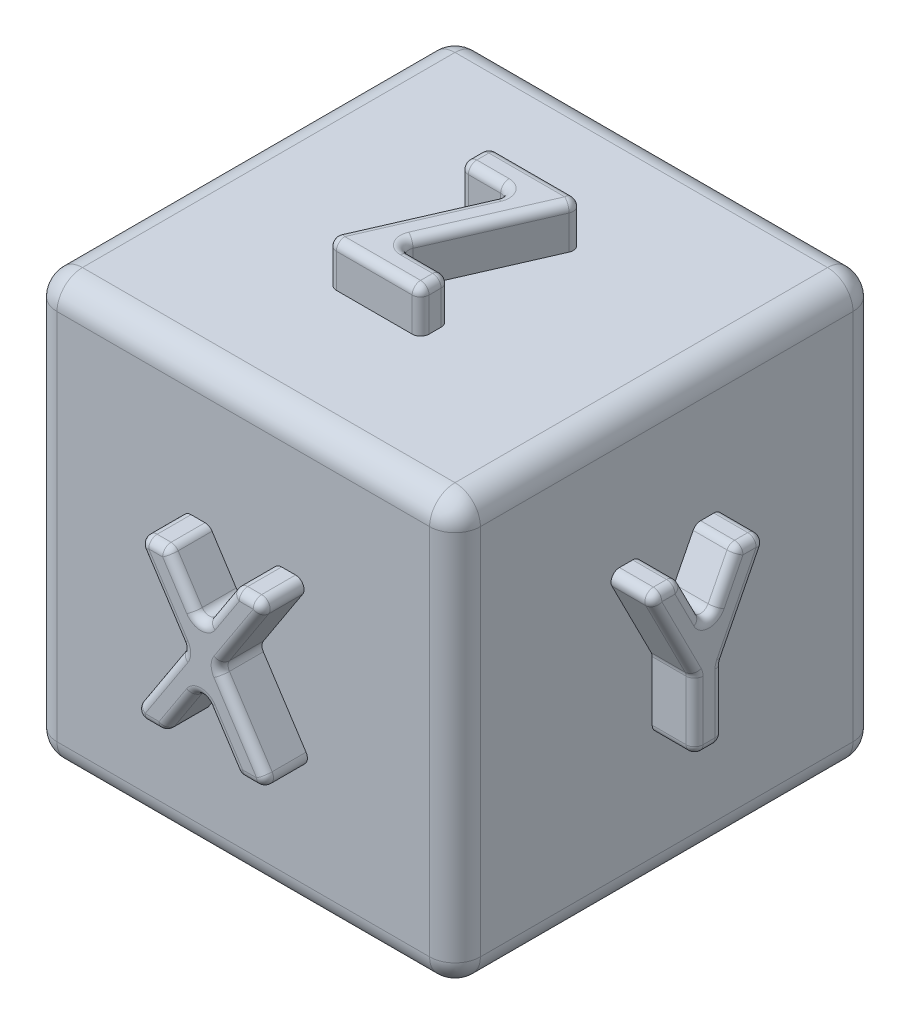
from build123d import *

# Parameters (mm, degrees)
SKETCH1_W           = 50
SKETCH1_H           = 50
BOSS_EXTRUDE1_DEPTH = 50
BOSS_EXTRUDE2_DEPTH = 5
BOSS_EXTRUDE3_DEPTH = 5
BOSS_EXTRUDE4_DEPTH = 5
CUT_EXTRUDE3_DEPTH  = 5
CUT_EXTRUDE4_DEPTH  = 5
CUT_EXTRUDE5_DEPTH  = 5
FILLET2_R           = 1
FILLET3_R           = 3


with BuildPart() as part:
    # Sketch1 → Boss-Extrude1 (new body)
    with BuildSketch(Plane(origin=(0, 0, 0), x_dir=(1, 0, 0), z_dir=(0, 1, 0))):
        Rectangle(SKETCH1_W, SKETCH1_H)
    extrude(amount=BOSS_EXTRUDE1_DEPTH)

    # Sketch2 → Boss-Extrude2 (add)
    with BuildSketch(Plane.XY.offset(25)):
        Polygon((-8.015554029, 34.140329571), (-3.985746337, 34.140329571), (-0.00554802, 28.023112022), (3.982282509, 34.140329571), (8.015906307, 34.140329571), (2.009355827, 24.928250244), (8.412781307, 15.090329571), (4.382973615, 15.090329571), (-0.00554802, 21.837204571), (-4.405517971, 15.090329571), (-8.43914177, 15.090329571), (-2.020451866, 24.932066349), align=None)
    extrude(amount=BOSS_EXTRUDE2_DEPTH)

    # Sketch3 → Boss-Extrude3 (add)
    with BuildSketch(Plane(origin=(25, 0, 0), x_dir=(0, 0, -1), z_dir=(1, 0, 0))):
        Polygon((-7.206017028, 34.603958948), (-3.401359576, 34.603958948), (-0.001209335, 27.921957746), (3.398940905, 34.603958948), (7.203598357, 34.603958948), (1.708406049, 23.804379621), (1.708406049, 15.553958948), (-1.71082472, 15.553958948), (-1.71082472, 23.804379621), align=None)
    extrude(amount=BOSS_EXTRUDE3_DEPTH)

    # Sketch4 → Boss-Extrude4 (add)
    with BuildSketch(Plane(origin=(0, 50, 0), x_dir=(1, 0, 0), z_dir=(0, 1, 0))):
        Polygon((-5.709861411, 9.711368917), (5.768984743, 9.711368917), (-1.054212372, -5.919400314), (5.280523205, -5.919400314), (5.280523205, -9.338631083), (-6.198322949, -9.338631083), (0.628690272, 6.292138148), (-5.709861411, 6.292138148), align=None)
    extrude(amount=BOSS_EXTRUDE4_DEPTH)

    # Sketch6 → Cut-Extrude3 (cut)
    with BuildSketch(Plane(origin=(0, 0, -25), x_dir=(-1, 0, 0), z_dir=(0, 0, -1))):
        Polygon((-8.412781307, 15.090329571), (-4.382973615, 15.090329571), (0.00554802, 21.837204571), (4.405517971, 15.090329571), (8.43914177, 15.090329571), (2.020451866, 24.932066349), (8.015554029, 34.140329571), (3.985746337, 34.140329571), (0.00554802, 28.023112022), (-3.982282509, 34.140329571), (-8.015906307, 34.140329571), (-2.009355827, 24.928250244), align=None)
    extrude(amount=-CUT_EXTRUDE3_DEPTH, mode=Mode.SUBTRACT)

    # Sketch7 → Cut-Extrude4 (cut)
    with BuildSketch(Plane.ZY.offset(25)):
        Polygon((-7.203598357, 34.603958948), (-1.708406049, 23.804379621), (-1.708406049, 15.553958948), (1.71082472, 15.553958948), (1.71082472, 23.804379621), (7.206017028, 34.603958948), (3.401359576, 34.603958948), (0.001209335, 27.921957746), (-3.398940905, 34.603958948), align=None)
    extrude(amount=-CUT_EXTRUDE4_DEPTH, mode=Mode.SUBTRACT)

    # Sketch8 → Cut-Extrude5 (cut)
    with BuildSketch(Plane.XZ):
        Polygon((-5.709861411, -9.711368917), (5.768984743, -9.711368917), (-1.054212372, 5.919400314), (5.280523205, 5.919400314), (5.280523205, 9.338631083), (-6.198322949, 9.338631083), (0.628690272, -6.292138148), (-5.709861411, -6.292138148), align=None)
    extrude(amount=-CUT_EXTRUDE5_DEPTH, mode=Mode.SUBTRACT)

    # Fillet2
    fillet2_edges = [part.edges().sort_by_distance(p)[0] for p in [
        (-6.000650183, 34.140329571, 30),
        (-1.995647178, 31.081720797, 30),
        (1.988367245, 31.081720797, 30),
        (5.999094408, 34.140329571, 30),
        (5.012631067, 29.534289907, 30),
        (5.211068567, 20.009289907, 30),
        (6.397877461, 15.090329571, 30),
        (2.188712798, 18.463767071, 30),
        (-2.205532995, 18.463767071, 30),
        (-6.42232987, 15.090329571, 30),
        (-5.229796818, 20.01119796, 30),
        (-5.018002947, 29.53619796, 30),
        (-0.00554802, 21.837204571, 27.5),
        (-8.43914177, 15.090329571, 27.5),
        (4.382973615, 15.090329571, 27.5),
        (-2.020451866, 24.932066349, 27.5),
        (-0.00554802, 28.023112022, 27.5),
        (8.412781307, 15.090329571, 27.5),
        (-4.405517971, 15.090329571, 27.5),
        (2.009355827, 24.928250244, 27.5),
        (8.015906307, 34.140329571, 27.5),
        (3.982282509, 34.140329571, 27.5),
        (-8.015554029, 34.140329571, 27.5),
        (-3.985746337, 34.140329571, 27.5),
        (0.029561666, 55, -9.711368917),
        (2.357386185, 55, -1.895984302),
        (2.113155416, 55, 5.919400314),
        (5.280523205, 55, 7.629015698),
        (-0.458899872, 55, 9.338631083),
        (-2.784816339, 55, 1.523246468),
        (-2.540585569, 55, -6.292138148),
        (-5.709861411, 55, -8.001753532),
        (30, 34.603958948, 5.303688302),
        (30, 31.262958347, 1.701284456),
        (30, 31.262958347, -1.698865785),
        (30, 34.603958948, -5.301269631),
        (30, 29.204169284, -4.456002203),
        (30, 19.679169284, -1.708406049),
        (30, 15.553958948, 0.001209335),
        (30, 19.679169284, 1.71082472),
        (30, 29.204169284, 4.458420874),
        (-2.540585569, 5, -6.292138148),
        (-2.784816339, 5, 1.523246468),
        (-0.458899872, 5, 9.338631083),
        (5.280523205, 5, 7.629015698),
        (2.113155416, 5, 5.919400314),
        (2.357386185, 5, -1.895984302),
        (0.029561666, 5, -9.711368917),
        (-5.709861411, 5, -8.001753532),
        (-20, 31.262958347, -1.698865785),
        (-20, 31.262958347, 1.701284456),
        (-20, 34.603958948, 5.303688302),
        (-20, 29.204169284, 4.458420874),
        (-20, 19.679169284, 1.71082472),
        (-20, 15.553958948, 0.001209335),
        (-20, 19.679169284, -1.708406049),
        (-20, 29.204169284, -4.456002203),
        (-20, 34.603958948, -5.301269631),
        (5.012631067, 29.534289907, -20),
        (5.999094408, 34.140329571, -20),
        (1.988367245, 31.081720797, -20),
        (-1.995647178, 31.081720797, -20),
        (-6.000650183, 34.140329571, -20),
        (-5.018002947, 29.53619796, -20),
        (-5.229796818, 20.01119796, -20),
        (-6.42232987, 15.090329571, -20),
        (-2.205532995, 18.463767071, -20),
        (2.188712798, 18.463767071, -20),
        (6.397877461, 15.090329571, -20),
        (5.211068567, 20.009289907, -20),
        (5.768984743, 2.5, -9.711368917),
        (5.280523205, 2.5, 5.919400314),
        (5.280523205, 2.5, 9.338631083),
        (-6.198322949, 2.5, 9.338631083),
        (-5.709861411, 2.5, -9.711368917),
        (-5.709861411, 2.5, -6.292138148),
        (0.628690272, 2.5, -6.292138148),
        (-1.054212372, 2.5, 5.919400314),
        (-22.5, 15.553958948, 1.71082472),
        (-22.5, 23.804379621, 1.71082472),
        (-22.5, 34.603958948, -3.398940905),
        (-22.5, 34.603958948, 7.206017028),
        (-22.5, 34.603958948, 3.401359576),
        (-22.5, 34.603958948, -7.203598357),
        (-22.5, 27.921957746, 0.001209335),
        (-22.5, 15.553958948, -1.708406049),
        (-22.5, 23.804379621, -1.708406049),
        (-8.015554029, 34.140329571, -22.5),
        (8.015906307, 34.140329571, -22.5),
        (-3.985746337, 34.140329571, -22.5),
        (3.982282509, 34.140329571, -22.5),
        (-2.020451866, 24.932066349, -22.5),
        (-0.00554802, 28.023112022, -22.5),
        (2.009355827, 24.928250244, -22.5),
        (8.412781307, 15.090329571, -22.5),
        (4.382973615, 15.090329571, -22.5),
        (-0.00554802, 21.837204571, -22.5),
        (-4.405517971, 15.090329571, -22.5),
        (-8.43914177, 15.090329571, -22.5),
        (5.280523205, 52.5, 5.919400314),
        (-1.054212372, 52.5, 5.919400314),
        (5.280523205, 52.5, 9.338631083),
        (-6.198322949, 52.5, 9.338631083),
        (0.628690272, 52.5, -6.292138148),
        (5.768984743, 52.5, -9.711368917),
        (-5.709861411, 52.5, -6.292138148),
        (-5.709861411, 52.5, -9.711368917),
        (27.5, 23.804379621, 1.71082472),
        (27.5, 15.553958948, -1.708406049),
        (27.5, 15.553958948, 1.71082472),
        (27.5, 23.804379621, -1.708406049),
        (27.5, 34.603958948, -7.203598357),
        (27.5, 34.603958948, -3.398940905),
        (27.5, 27.921957746, 0.001209335),
        (27.5, 34.603958948, 7.206017028),
        (27.5, 34.603958948, 3.401359576),
    ]]
    fillet(fillet2_edges, radius=FILLET2_R)

    # Fillet3
    fillet3_edges = [part.edges().sort_by_distance(p)[0] for p in [
        (25, 50, 0),
        (25, 25, -25),
        (0, 50, -25),
        (0, 0, -25),
        (25, 0, 0),
        (25, 25, 25),
        (-25, 25, -25),
        (-25, 50, 0),
        (0, 50, 25),
        (0, 0, 25),
        (-25, 0, 0),
        (-25, 25, 25),
    ]]
    fillet(fillet3_edges, radius=FILLET3_R)


solid = part.part
